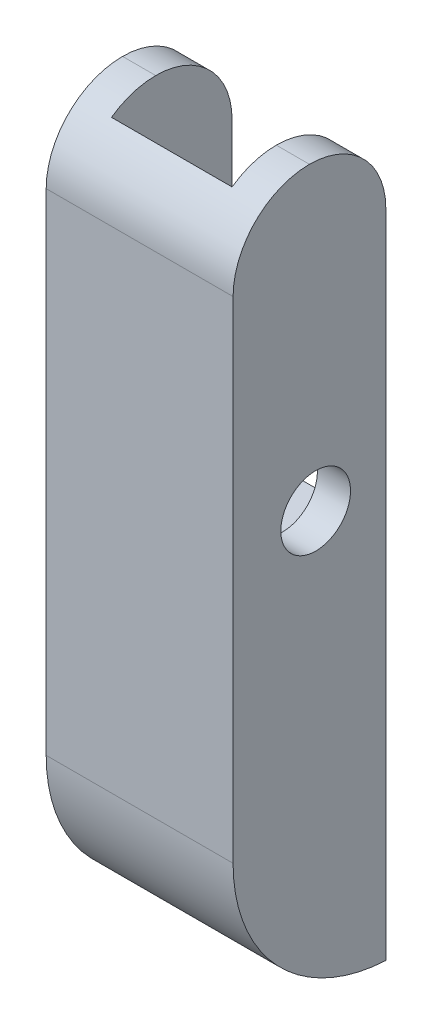
from build123d import *

# Parameters (mm, degrees)
SKETCH1_W               = 11.811
SKETCH1_H               = 45.98924
BOSS_EXTRUDE1_DEPTH     = 9.652
FILLET5_R               = 4.826
SKETCH2_W               = 7.62
SKETCH2_H               = 22.352
CUT_EXTRUDE1_DEPTH      = 7.62
CUT_EXTRUDE2_DEPTH      = 49.452771033
CUT_EXTRUDE2_DEPTH_BACK = 49.452771033
SKETCH3_R               = 2.20345
FILLET4_R               = 4.826
FILLET6_R               = 10.16


with BuildPart() as part:
    # Sketch1 → Boss-Extrude1 (new body)
    with BuildSketch(Plane.XY):
        with Locations((5.9055, 22.99462)):
            Rectangle(SKETCH1_W, SKETCH1_H)
    extrude(amount=BOSS_EXTRUDE1_DEPTH)

    # Fillet5
    fillet5_edges = [part.edges().sort_by_distance(p)[0] for p in [
        (5.9055, 45.98924, 0),
    ]]
    fillet(fillet5_edges, radius=FILLET5_R)

    # Sketch2 → Cut-Extrude1 (cut)
    with BuildSketch(Plane(origin=(0, 0, 0), x_dir=(-1, 0, 0), z_dir=(0, 0, -1))):
        with Locations((-5.9055, 34.81324)):
            Rectangle(SKETCH2_W, SKETCH2_H)
    extrude(amount=-CUT_EXTRUDE1_DEPTH, mode=Mode.SUBTRACT)

    # Sketch3 → Cut-Extrude2 (cut, two sides: drawn at the far end of the back side and taken through both)
    with BuildSketch(Plane.ZY.offset(-CUT_EXTRUDE2_DEPTH_BACK)):
        with Locations((4.4323, 26.82494)):
            Circle(SKETCH3_R)
    extrude(amount=CUT_EXTRUDE2_DEPTH + CUT_EXTRUDE2_DEPTH_BACK, mode=Mode.SUBTRACT)

    # Fillet4
    # the kernel refuses this fillet: 4.826 mm, written as the material it takes off along each edge
    with BuildSketch(Plane(origin=(23.876, 45.98924, 9.652), x_dir=(0, 0, -1), z_dir=(-1, 0, 0))) as fillet4_piece_1:
        with BuildLine():
            CenterArc((FILLET4_R, FILLET4_R), FILLET4_R, 180, 90)
            Line((0, FILLET4_R), (0, 0))
            Line((0, 0), (FILLET4_R, 0))
        make_face()
    extrude(amount=35.941, mode=Mode.SUBTRACT)

    # Fillet6
    # the kernel refuses this fillet: 10.16 mm, written as the material it takes off along each edge
    with BuildSketch(Plane(origin=(-25.368230131, 0, 9.652), x_dir=(0, 1, 0), z_dir=(1, 0, 0))) as fillet6_piece_1:
        with BuildLine():
            CenterArc((10.147292053, -10.16), FILLET6_R, 90, 87.134016017)
            Line((0, -9.652), (-0.202945841, -9.64184))
            ThreePointArc((-0.202945841, -9.64184), (-0.2032, -4.826), (-0.2032, 0))
            Line((-0.2032, 0), (0, 0.2032))
            Line((0, 0.2032), (10.147292053, 0.2032))
            Line((10.147292053, 0.2032), (10.147292053, 0))
        make_face()
    extrude(amount=62.547460263, mode=Mode.SUBTRACT)


solid = part.part
